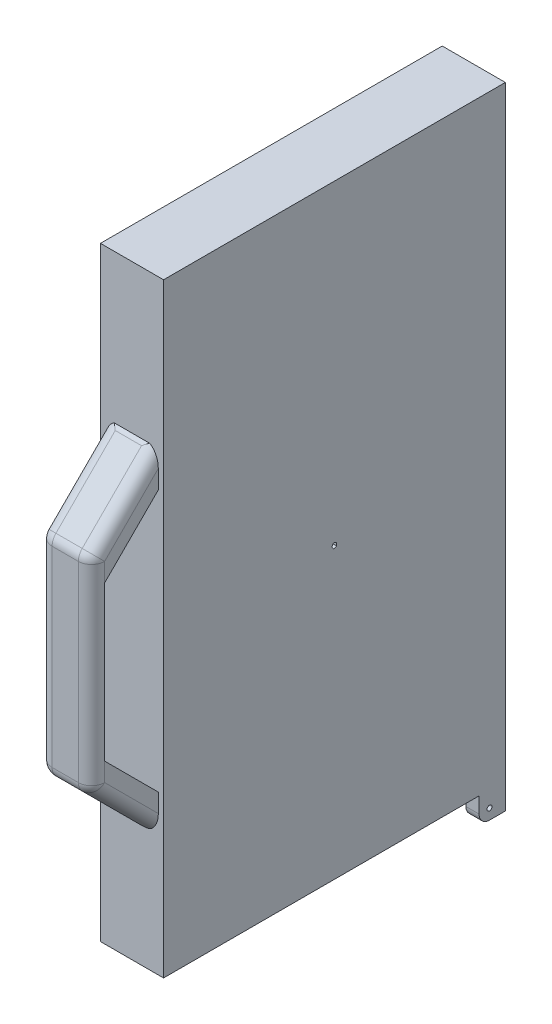
from build123d import *

# Parameters (mm, degrees)
SKETCH1_W           = 240
SKETCH1_H           = 130
BOSS_EXTRUDE1_DEPTH = 12
SKETCH2_W           = 220
SKETCH2_H           = 110
CUT_EXTRUDE2_DEPTH  = 10
CUT_EXTRUDE3_DEPTH  = 137.839321834
SKETCH4_W           = 20
SKETCH4_H           = 127
BOSS_EXTRUDE2_DEPTH = 25.4
CHAMFER1_SIZE       = 25
SHELL1_START        = -10
SHELL1_DEPTH        = 20
FILLET1_R           = 5
CHAMFER2_SIZE       = 5
SKETCH6_W           = 10
SKETCH6_H           = 120
CUT_EXTRUDE5_DEPTH  = 153.145193812
SKETCH9_W           = 14
SKETCH9_H           = 8
CUT_EXTRUDE7_DEPTH  = 10
SKETCH11_R          = 0.95
CUT_EXTRUDE8_DEPTH  = 153.145193812
FILLET3_R           = 4


with BuildPart() as part:
    # Sketch1 → Boss-Extrude1 (new body)
    with BuildSketch(Plane.YZ):
        Rectangle(SKETCH1_W, SKETCH1_H)
    extrude(amount=-BOSS_EXTRUDE1_DEPTH)

    # Sketch2 → Cut-Extrude2 (cut)
    with BuildSketch(Plane.YZ):
        Rectangle(SKETCH2_W, SKETCH2_H)
    extrude(amount=-CUT_EXTRUDE2_DEPTH, mode=Mode.SUBTRACT)

    # Sketch3 → Cut-Extrude3 (cut, through all)
    with BuildSketch(Plane.YZ.offset(-10)):
        Polygon((0, 1.051462224), (-1, 0.324919696), (-0.618033989, -0.850650808), (0.618033989, -0.850650808), (1, 0.324919696), align=None)
    extrude(amount=-CUT_EXTRUDE3_DEPTH, mode=Mode.SUBTRACT)

    # Mirror6: part across plane


with BuildPart() as part_1:
    add(part.part)
    add(part.part.mirror(Plane.ZY))

    # Sketch4 → Boss-Extrude2 (add)
    with BuildSketch(Plane.XY.offset(65)):
        Rectangle(SKETCH4_W, SKETCH4_H)
    extrude(amount=BOSS_EXTRUDE2_DEPTH)

    # Chamfer1
    chamfer1_edges = [part_1.edges().sort_by_distance(p)[0] for p in [
        (0, 63.5, 90.4),
        (0, -63.5, 90.4),
    ]]
    chamfer(chamfer1_edges, length=CHAMFER1_SIZE)

    # Shell1: read off the stored shape, not the designer's step
    # Shell1 outline → Shell1 (cut)
    with BuildSketch(Plane.YZ.offset(SHELL1_START)):
        Polygon((-49.757864376, 65), (49.757864376, 65), (34.357864376, 80.4), (-34.357864376, 80.4), align=None)
    extrude(amount=SHELL1_DEPTH, mode=Mode.SUBTRACT)

    # Fillet1
    # the kernel refuses this fillet: 5 mm, written as the material it takes off along each edge
    with BuildSketch(Plane(origin=(5, -36.428932188, 85.4), x_dir=(0, 0, 1), z_dir=(1, 0, 0))) as fillet1_piece_1_section:
        Polygon((0, 0), (FILLET1_R * 1.02, 0), (FILLET1_R * 1.02, FILLET1_R * 0.422497833621), (FILLET1_R * 0.72124891681, FILLET1_R * 0.72124891681), align=None)
    fillet1_piece_1 = extrude(amount=FILLET1_R * 1.02, mode=Mode.PRIVATE)
    fillet1_piece_1 = fillet1_piece_1 - Plane(origin=(5, -36.428932188, 85.4), x_dir=(0, 0.3826834323650898, -0.9238795325112867), z_dir=(1, 0, 0)) * Sphere(FILLET1_R, mode=Mode.PRIVATE)
    add(fillet1_piece_1, mode=Mode.SUBTRACT)
    with BuildSketch(Plane(origin=(-5, -36.428932188, 85.4), x_dir=(0, -0.7071067811865476, 0.7071067811865476), z_dir=(-1, 0, 0))) as fillet1_piece_2_section:
        Polygon((0, 0), (FILLET1_R * 1.02, 0), (FILLET1_R * 1.02, FILLET1_R * 0.422497833621), (FILLET1_R * 0.72124891681, FILLET1_R * 0.72124891681), align=None)
    fillet1_piece_2 = extrude(amount=FILLET1_R * 1.02, mode=Mode.PRIVATE)
    fillet1_piece_2 = fillet1_piece_2 - Plane(origin=(-5, -36.428932188, 85.4), x_dir=(0, 0.3826834323650898, -0.9238795325112867), z_dir=(-1, 0, 0)) * Sphere(FILLET1_R, mode=Mode.PRIVATE)
    add(fillet1_piece_2, mode=Mode.SUBTRACT)
    with BuildSketch(Plane(origin=(-5, 36.428932188, 85.4), x_dir=(0, 0.7071067811865476, 0.7071067811865476), z_dir=(-1, 0, 0))) as fillet1_piece_3_section:
        Polygon((0, 0), (FILLET1_R * 1.02, 0), (FILLET1_R * 1.02, -FILLET1_R * 0.422497833621), (FILLET1_R * 0.72124891681, -FILLET1_R * 0.72124891681), align=None)
    fillet1_piece_3 = extrude(amount=FILLET1_R * 1.02, mode=Mode.PRIVATE)
    fillet1_piece_3 = fillet1_piece_3 - Plane(origin=(-5, 36.428932188, 85.4), x_dir=(0, -0.3826834323650898, -0.9238795325112867), z_dir=(-1, 0, 0)) * Sphere(FILLET1_R, mode=Mode.PRIVATE)
    add(fillet1_piece_3, mode=Mode.SUBTRACT)
    with BuildSketch(Plane(origin=(5, 36.428932188, 85.4), x_dir=(0, 0, 1), z_dir=(1, 0, 0))) as fillet1_piece_4_section:
        Polygon((0, 0), (FILLET1_R * 1.02, 0), (FILLET1_R * 1.02, -FILLET1_R * 0.422497833621), (FILLET1_R * 0.72124891681, -FILLET1_R * 0.72124891681), align=None)
    fillet1_piece_4 = extrude(amount=FILLET1_R * 1.02, mode=Mode.PRIVATE)
    fillet1_piece_4 = fillet1_piece_4 - Plane(origin=(5, 36.428932188, 85.4), x_dir=(0, -0.3826834323650898, -0.9238795325112867), z_dir=(1, 0, 0)) * Sphere(FILLET1_R, mode=Mode.PRIVATE)
    add(fillet1_piece_4, mode=Mode.SUBTRACT)
    with BuildSketch(Plane(origin=(10, -72.338834765, 56.561165235), x_dir=(-1, 0, 0), z_dir=(0, 0.7071067811865476, 0.7071067811865476))) as fillet1_piece_5_section:
        with BuildLine():
            CenterArc((FILLET1_R, -FILLET1_R), FILLET1_R, 90, 90)
            Line((0, -FILLET1_R), (0, 0))
            Line((0, 0), (FILLET1_R, 0))
        make_face()
    fillet1_piece_5 = extrude(amount=45.784271247, mode=Mode.PRIVATE)
    fillet1_piece_5 = split(fillet1_piece_5, bisect_by=Plane(origin=(10, -72.338834765, 65), z_dir=(0, 0, 1)), keep=Keep.TOP, mode=Mode.PRIVATE)
    add(fillet1_piece_5, mode=Mode.SUBTRACT)
    with BuildSketch(Plane(origin=(-13.437488438, -63.5, 65.4), x_dir=(0, 0, -1), z_dir=(1, 0, 0)), Plane(origin=(13.437488438, 63.5, 65.4), x_dir=(0, 0, -1), z_dir=(-1, 0, 0))) as fillet1_piece_6:
        with BuildLine():
            CenterArc((2.563265352, 4.50780246), FILLET1_R, 225, 19.363951138)
            Line((-0.972268554, 0.972268554), (0, 0))
            Line((0, 0), (0.4, 0))
        make_face()
    extrude(amount=26.874976876, mode=Mode.SUBTRACT)
    with BuildSketch(Plane(origin=(-10, -72.338834765, 56.561165235), x_dir=(0, 0.7071067811865476, -0.7071067811865476), z_dir=(0, 0.7071067811865476, 0.7071067811865476))) as fillet1_piece_7_section:
        with BuildLine():
            CenterArc((FILLET1_R, -FILLET1_R), FILLET1_R, 90, 90)
            Line((0, -FILLET1_R), (0, 0))
            Line((0, 0), (FILLET1_R, 0))
        make_face()
    fillet1_piece_7 = extrude(amount=45.784271247, mode=Mode.PRIVATE)
    fillet1_piece_7 = split(fillet1_piece_7, bisect_by=Plane(origin=(-10, -72.338834765, 65), z_dir=(0, 0, 1)), keep=Keep.TOP, mode=Mode.PRIVATE)
    add(fillet1_piece_7, mode=Mode.SUBTRACT)
    with BuildSketch(Plane(origin=(-5, -38.5, 90.4), x_dir=(0, -0.7071067811865476, -0.7071067811865476), z_dir=(1, 0, 0))) as fillet1_piece_8:
        with BuildLine():
            CenterArc((FILLET1_R * 0.414213562373, FILLET1_R), FILLET1_R, 225, 45)
            Line((-FILLET1_R * 0.292893218813, FILLET1_R * 0.292893218813), (0, 0))
            Line((0, 0), (FILLET1_R * 0.414213562373, 0))
        make_face()
    extrude(amount=10, mode=Mode.SUBTRACT)
    with BuildSketch(Plane(origin=(-10, 36.428932188, 90.4), x_dir=(0, 0, -1), z_dir=(0, -1, 0)), Plane(origin=(10, -36.428932188, 90.4), x_dir=(0, 0, -1), z_dir=(0, 1, 0))) as fillet1_piece_9:
        with BuildLine():
            CenterArc((FILLET1_R, FILLET1_R), FILLET1_R, 180, 90)
            Line((0, FILLET1_R), (0, 0))
            Line((0, 0), (FILLET1_R, 0))
        make_face()
    extrude(amount=72.857864376, mode=Mode.SUBTRACT)
    with BuildSketch(Plane(origin=(5, 38.5, 90.4), x_dir=(0, -1, 0), z_dir=(-1, 0, 0))) as fillet1_piece_10:
        with BuildLine():
            CenterArc((FILLET1_R * 0.414213562373, -FILLET1_R), FILLET1_R, 90, 45)
            Line((-FILLET1_R * 0.292893218813, -FILLET1_R * 0.292893218813), (0, 0))
            Line((0, 0), (FILLET1_R * 0.414213562373, 0))
        make_face()
    extrude(amount=10, mode=Mode.SUBTRACT)
    with BuildSketch(Plane(origin=(-10, 72.338834765, 56.561165235), x_dir=(0, -0.7071067811865476, -0.7071067811865476), z_dir=(0, -0.7071067811865476, 0.7071067811865476))) as fillet1_piece_11_section:
        with BuildLine():
            CenterArc((FILLET1_R, FILLET1_R), FILLET1_R, 180, 90)
            Line((0, FILLET1_R), (0, 0))
            Line((0, 0), (FILLET1_R, 0))
        make_face()
    fillet1_piece_11 = extrude(amount=45.784271247, mode=Mode.PRIVATE)
    fillet1_piece_11 = split(fillet1_piece_11, bisect_by=Plane(origin=(-10, 72.338834765, 65), z_dir=(0, 0, 1)), keep=Keep.TOP, mode=Mode.PRIVATE)
    add(fillet1_piece_11, mode=Mode.SUBTRACT)
    with BuildSketch(Plane(origin=(10, 72.338834765, 56.561165235), x_dir=(0, -0.7071067811865476, -0.7071067811865476), z_dir=(0, -0.7071067811865476, 0.7071067811865476))) as fillet1_piece_12_section:
        with BuildLine():
            CenterArc((FILLET1_R, -FILLET1_R), FILLET1_R, 90, 90)
            Line((0, -FILLET1_R), (0, 0))
            Line((0, 0), (FILLET1_R, 0))
        make_face()
    fillet1_piece_12 = extrude(amount=45.784271247, mode=Mode.PRIVATE)
    fillet1_piece_12 = split(fillet1_piece_12, bisect_by=Plane(origin=(10, 72.338834765, 65), z_dir=(0, 0, 1)), keep=Keep.TOP, mode=Mode.PRIVATE)
    add(fillet1_piece_12, mode=Mode.SUBTRACT)

    # Chamfer2
    chamfer2_edges = [part_1.edges().sort_by_distance(p)[0] for p in [
        (10, 0, 80.4),
        (-10, 0, 80.4),
    ]]
    chamfer(chamfer2_edges, length=CHAMFER2_SIZE - 0.0001)  # a hair under: the kernel refuses the full size

    # Sketch6 → Cut-Extrude5 (cut, through all)
    with BuildSketch(Plane(origin=(-12, 0, 0), x_dir=(0, -1, 0), z_dir=(-1, 0, 0))):
        with Locations((115, 5)):
            Rectangle(SKETCH6_W, SKETCH6_H)
    extrude(amount=-CUT_EXTRUDE5_DEPTH, mode=Mode.SUBTRACT)

    # Sketch9 → Cut-Extrude7 (cut)
    with BuildSketch(Plane.XZ.offset(120)):
        with Locations((0, -59)):
            Rectangle(SKETCH9_W, SKETCH9_H)
    extrude(amount=-CUT_EXTRUDE7_DEPTH, mode=Mode.SUBTRACT)

    # Sketch11 → Cut-Extrude8 (cut, through all)
    with BuildSketch(Plane(origin=(-12, 0, 0), x_dir=(0, -1, 0), z_dir=(-1, 0, 0))):
        with Locations(Location((116, -59, 0), (0, 0, 90))):
            Circle(SKETCH11_R)
    extrude(amount=-CUT_EXTRUDE8_DEPTH, mode=Mode.SUBTRACT)

    # Fillet3
    fillet3_edges = [part_1.edges().sort_by_distance(p)[0] for p in [
        (9.5, -120, -55),
        (-9.5, -120, -55),
    ]]
    fillet(fillet3_edges, radius=FILLET3_R)


solid = part_1.part
